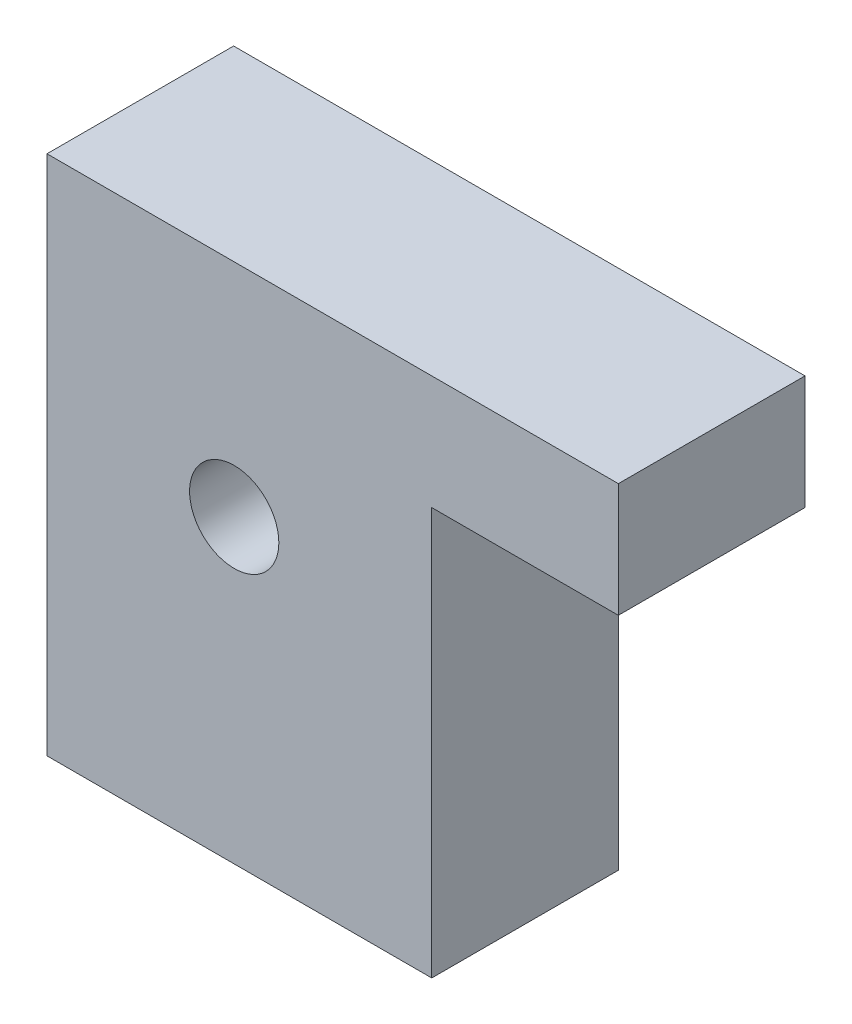
from build123d import *

# Parameters (mm, degrees)
SKIZZE1_W                       = 20.615840772
SKIZZE1_H                       = 27.939889468
AUFSATZ_LINEAR_AUSTRAGEN1_DEPTH = 10
SKIZZE3_W                       = 10
SKIZZE3_H                       = 6.110433848
AUFSATZ_LINEAR_AUSTRAGEN2_DEPTH = 10
SKIZZE2_R                       = 2.391280319
SCHNITT_LINEAR_AUSTRAGEN1_DEPTH = 10


with BuildPart() as part:
    # Skizze1 → Aufsatz-Linear austragen1 (new body)
    with BuildSketch(Plane.XY):
        with Locations((10.307920386, -13.969944734)):
            Rectangle(SKIZZE1_W, SKIZZE1_H)
    extrude(amount=AUFSATZ_LINEAR_AUSTRAGEN1_DEPTH)

    # Skizze3 → Aufsatz-Linear austragen2 (add)
    with BuildSketch(Plane(origin=(20.615840772, 0, 0), x_dir=(0, 0, -1), z_dir=(1, 0, 0))):
        with Locations((-5, -3.055216924)):
            Rectangle(SKIZZE3_W, SKIZZE3_H)
    extrude(amount=AUFSATZ_LINEAR_AUSTRAGEN2_DEPTH)

    # Skizze2 → Schnitt-Linear austragen1 (cut)
    with BuildSketch(Plane.XY.offset(10)):
        with Locations((10.03139494, -11.838432752)):
            Circle(SKIZZE2_R)
    extrude(amount=-SCHNITT_LINEAR_AUSTRAGEN1_DEPTH, mode=Mode.SUBTRACT)


solid = part.part
